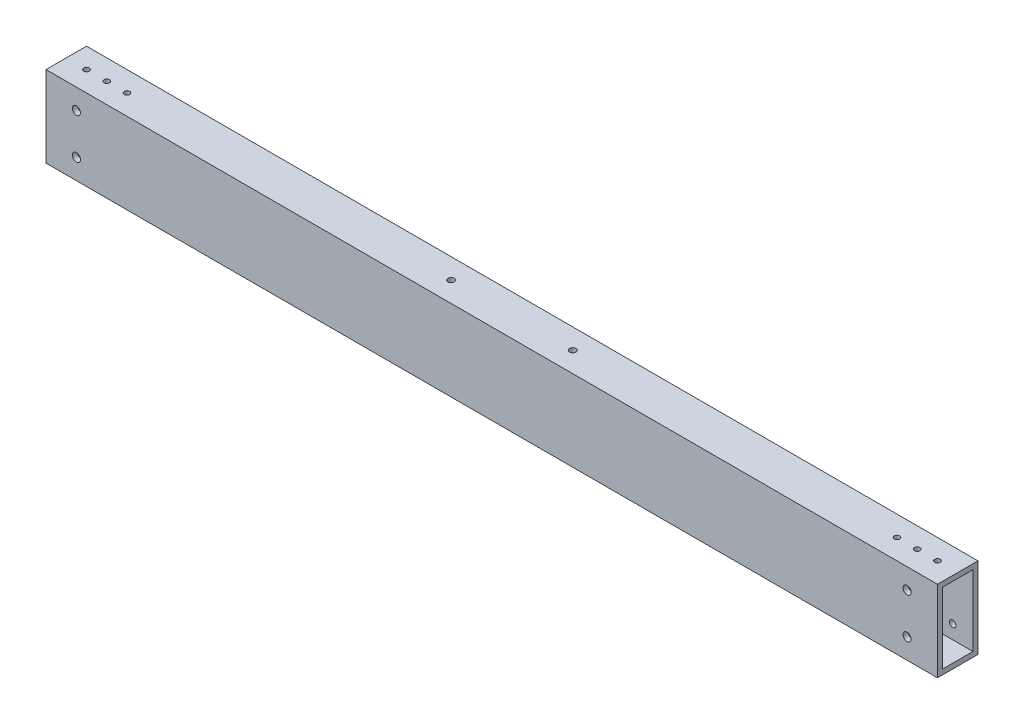
from build123d import *

# Parameters (mm, degrees)
SKETCH1_W                       = 558.8
SKETCH1_H                       = 50.8
BOSS_EXTRUDE1_DEPTH             = 12.7
SKETCH2_W                       = 19.05
SKETCH2_H                       = 44.45
CUT_EXTRUDE1_DEPTH              = 560.521125607
SKETCH4_R                       = 1.7272
CUT_EXTRUDE2_DEPTH              = 6.35
F_1_4_20_TAPPED_HOLE1_D         = 5.1054
F_1_4_20_TAPPED_HOLE1_DEPTH     = 5.08
F_1_4_20_TAPPED_HOLE1_TIP       = 1.533816902
F_10_32_TAPPED_HOLE1_D          = 4.0386
F_10_32_TAPPED_HOLE1_DEPTH      = 5.08
F_10_32_TAPPED_HOLE1_TIP        = 1.213317848
F_5_32_0_15625_DIAMETER_HOLE1_D = 3.96875


with BuildPart() as part:
    # Sketch1 → Boss-Extrude1 (new, symmetric)
    with BuildSketch(Plane.XY):
        Rectangle(SKETCH1_W, SKETCH1_H)
    extrude(amount=BOSS_EXTRUDE1_DEPTH, both=True)

    # Sketch2 → Cut-Extrude1 (cut, through all)
    with BuildSketch(Plane(origin=(279.4, 0, 0), x_dir=(0, 0, -1), z_dir=(1, 0, 0))):
        Rectangle(SKETCH2_W, SKETCH2_H)
    extrude(amount=-CUT_EXTRUDE1_DEPTH, mode=Mode.SUBTRACT)

    # Sketch4 → Cut-Extrude2 (cut)
    with BuildSketch(Plane(origin=(0, 25.4, 0), x_dir=(1, 0, 0), z_dir=(0, 1, 0))):
        with Locations((-304.8, 0)):
            Circle(SKETCH4_R)
        with Locations((-292.1, 0)):
            Circle(SKETCH4_R)
        with Locations((-266.7, 0)):
            Circle(SKETCH4_R)
        with Locations((-254, 0)):
            Circle(SKETCH4_R)
        with Locations((-241.3, 0)):
            Circle(SKETCH4_R)
        with Locations((241.3, 0)):
            Circle(SKETCH4_R)
        with Locations((254, 0)):
            Circle(SKETCH4_R)
        with Locations((266.7, 0)):
            Circle(SKETCH4_R)
    extrude(amount=-CUT_EXTRUDE2_DEPTH, mode=Mode.SUBTRACT)

    # 1/4-20 Tapped Hole1
    with Locations(Plane.XY.offset(12.7)):
        with Locations((-260.35, 12.7), (-260.35, -12.7), (260.35, 12.7), (260.35, -12.7)):
            Hole(F_1_4_20_TAPPED_HOLE1_D / 2, depth=F_1_4_20_TAPPED_HOLE1_DEPTH)
            with Locations((0, 0, -(F_1_4_20_TAPPED_HOLE1_DEPTH + F_1_4_20_TAPPED_HOLE1_TIP / 2))):  # 118° drill point
                Cone(0, F_1_4_20_TAPPED_HOLE1_D / 2, F_1_4_20_TAPPED_HOLE1_TIP, mode=Mode.SUBTRACT)

    # #10-32 Tapped Hole1
    with Locations(Plane(origin=(0, 0, -12.7), x_dir=(-1, 0, 0), z_dir=(0, 0, -1))):
        with Locations((-266.7, -13.49375), (-190.5, -13.49375), (-114.3, -13.49375), (-38.1, -13.49375), (38.1, -13.49375), (114.3, -13.49375), (190.5, -13.49375), (266.7, -13.49375)):
            Hole(F_10_32_TAPPED_HOLE1_D / 2, depth=F_10_32_TAPPED_HOLE1_DEPTH)
            with Locations((0, 0, -(F_10_32_TAPPED_HOLE1_DEPTH + F_10_32_TAPPED_HOLE1_TIP / 2))):  # 118° drill point
                Cone(0, F_10_32_TAPPED_HOLE1_D / 2, F_10_32_TAPPED_HOLE1_TIP, mode=Mode.SUBTRACT)

    # 5/32 (0.15625) Diameter Hole1 (through all)
    with Locations(Plane(origin=(0, 25.4, 0), x_dir=(1, 0, 0), z_dir=(0, 1, 0))):
        with Locations((-38.1, 0), (38.1, 0)):
            Hole(F_5_32_0_15625_DIAMETER_HOLE1_D / 2)


solid = part.part
